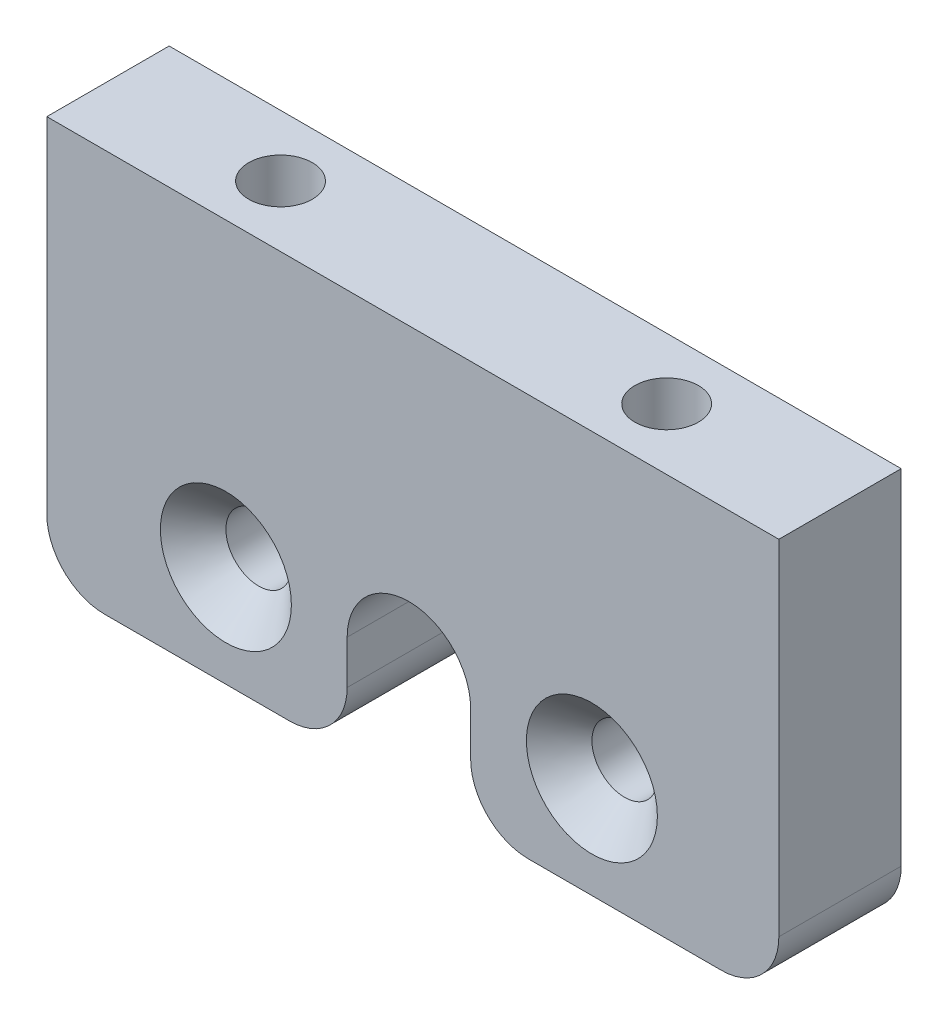
from build123d import *

# Parameters (mm, degrees)
SKETCH1_R           = 1.7
BOSS_EXTRUDE1_DEPTH = 6.35
CHAMFER1_SIZE       = 1.7
SKETCH2_R           = 1.65
CUT_EXTRUDE1_DEPTH  = 10
FILLET1_R           = 3


with BuildPart() as part:
    # Sketch1 → Boss-Extrude1 (new body)
    with BuildSketch(Plane(origin=(7.6e-08, 0, -21.644897171), x_dir=(1.0, 0, 3.501429786466588e-09), z_dir=(-3.501429786466588e-09, 0, 1.0))):
        with BuildLine():
            Line((3.000021754, 7.262533291), (3.000021754, 1.9987))
            Line((3.000021754, 1.9987), (19.00000025, 1.9987))
            Line((19.00000025, 1.9987), (19.00000025, 22.8687))
            Line((19.00000025, 22.8687), (-19.00000025, 22.8687))
            Line((-19.00000025, 22.8687), (-19.00000025, 1.9987))
            Line((-19.00000025, 1.9987), (-3.409734271, 1.9987))
            Line((-3.409734271, 1.9987), (-3.409734271, 7.262533291))
            ThreePointArc((-3.409734271, 7.262533291), (-0.204856259, 10.467411304), (3.000021754, 7.262533291))
        make_face()
        with Locations((9.295143741, 7.262533291)):
            Circle(SKETCH1_R, mode=Mode.SUBTRACT)
        with Locations((-9.704856259, 7.262533291)):
            Circle(SKETCH1_R, mode=Mode.SUBTRACT)
    extrude(amount=BOSS_EXTRUDE1_DEPTH)

    # Chamfer1
    chamfer1_edges = [part.edges().sort_by_distance(p)[0] for p in [
        (-11.404856205, 7.262533291, -15.294897211),
        (7.595143795, 7.262533291, -15.294897144),
    ]]
    chamfer(chamfer1_edges, length=CHAMFER1_SIZE)

    # Sketch2 → Cut-Extrude1 (cut)
    with BuildSketch(Plane(origin=(0, 22.8687, 0), x_dir=(1, 0, 0), z_dir=(0, 1, 0))):
        with Locations((10, 18.469897104)):
            Circle(SKETCH2_R)
        with Locations((-10.042850258, 18.469897104)):
            Circle(SKETCH2_R)
    extrude(amount=-CUT_EXTRUDE1_DEPTH, mode=Mode.SUBTRACT)

    # Fillet1
    fillet1_edges = [part.edges().sort_by_distance(p)[0] for p in [
        (-19.000000186, 1.9987, -18.469897237),
        (-3.409734206, 1.9987, -18.469897183),
        (3.000021818, 1.9987, -18.46989716),
        (19.000000315, 1.9987, -18.469897104),
    ]]
    fillet(fillet1_edges, radius=FILLET1_R)


solid = part.part
